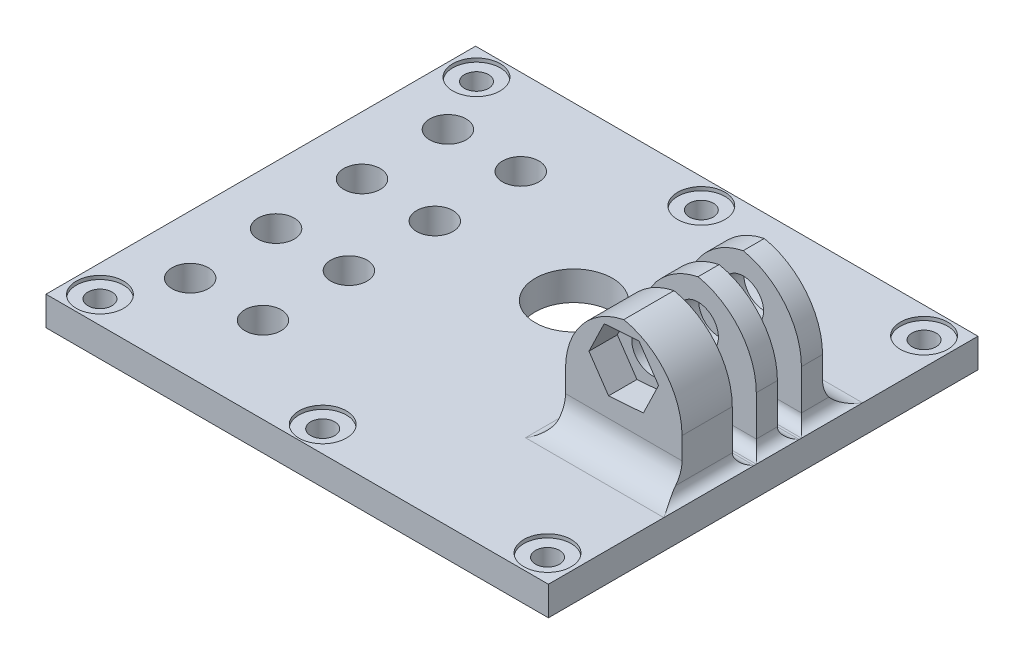
from build123d import *

# Parameters (mm, degrees)
SKETCH_1_W          = 69
SKETCH_1_H          = 59
EXTRUDE_1_DEPTH     = 4
SKETCH_2_R          = 1.65
CUT_EXTRUDE_1_DEPTH = 4
SKETCH_3_R          = 3.25
CUT_EXTRUDE_2_DEPTH = 0.5
SKETCH_4_W          = 16
SKETCH_4_H          = 2.9
SKETCH_4_H_2        = 6.9
EXTRUDE_2_DEPTH     = 17
SKETCH_5_R          = 2.8
CUT_EXTRUDE_3_DEPTH = 57.249199994
FILLET_1_R          = 10
FILLET_2_R          = 4
CUT_EXTRUDE_4_DEPTH = 3.9
FILLET_3_R          = 1.5
SKETCH_7_R          = 5.3
CUT_EXTRUDE_5_DEPTH = 4
SKETCH_8_R          = 2.5
CUT_EXTRUDE_6_DEPTH = 10


# Some blends are built 0.0001 mm under size
with BuildPart() as part:
    # Эскиз1 → Бобышка-Вытянуть1 (new body)
    with BuildSketch(Plane(origin=(0, 0, 0), x_dir=(1, 0, 0), z_dir=(0, 1, 0))):
        Rectangle(SKETCH_1_W, SKETCH_1_H)
    extrude(amount=EXTRUDE_1_DEPTH)

    # Эскиз2 → Вырез-Вытянуть1 (cut)
    with BuildSketch(Plane(origin=(0, 4, 0), x_dir=(1, 0, 0), z_dir=(0, 1, 0))):
        with Locations(Location((-30.734773913, -25.856238371, 0), (0, 0, 270))):
            Circle(SKETCH_2_R)
        with Locations(Location((-30.734773913, 25.856238371, 0), (0, 0, 270))):
            Circle(SKETCH_2_R)
        with Locations(Location((0, 26, 0), (0, 0, 270))):
            Circle(SKETCH_2_R)
        with Locations(Location((30.734773913, 25.856238371, 0), (0, 0, 270))):
            Circle(SKETCH_2_R)
        with Locations(Location((30.734773913, -25.856238371, 0), (0, 0, 270))):
            Circle(SKETCH_2_R)
        with Locations(Location((0, -26, 0), (0, 0, 270))):
            Circle(SKETCH_2_R)
    extrude(amount=-CUT_EXTRUDE_1_DEPTH, mode=Mode.SUBTRACT)

    # Эскиз3 → Вырез-Вытянуть2 (cut)
    with BuildSketch(Plane(origin=(0, 4, 0), x_dir=(1, 0, 0), z_dir=(0, 1, 0))):
        with Locations(Location((-30.734773913, 25.856238371, 0), (0, 0, 270))):
            Circle(SKETCH_3_R)
        with Locations(Location((0, 26, 0), (0, 0, 270))):
            Circle(SKETCH_3_R)
        with Locations(Location((30.734773913, 25.856238371, 0), (0, 0, 270))):
            Circle(SKETCH_3_R)
        with Locations(Location((30.734773913, -25.856238371, 0), (0, 0, 270))):
            Circle(SKETCH_3_R)
        with Locations(Location((0, -26, 0), (0, 0, 270))):
            Circle(SKETCH_3_R)
        with Locations(Location((-30.734773913, -25.856238371, 0), (0, 0, 270))):
            Circle(SKETCH_3_R)
    extrude(amount=-CUT_EXTRUDE_2_DEPTH, mode=Mode.SUBTRACT)

    # Эскиз4 → Бобышка-Вытянуть2 (add)
    with BuildSketch(Plane(origin=(0, 4, 0), x_dir=(1, 0, 0), z_dir=(0, 1, 0))):
        with Locations((25, 8.2)):
            Rectangle(SKETCH_4_W, SKETCH_4_H)
        with Locations((25, 2)):
            Rectangle(SKETCH_4_W, SKETCH_4_H)
        with Locations((25, -6.2)):
            Rectangle(SKETCH_4_W, SKETCH_4_H_2)
    extrude(amount=EXTRUDE_2_DEPTH)

    # Эскиз5 → Вырез-Вытянуть3 (cut, through all)
    with BuildSketch(Plane(origin=(0, 0, -9.65), x_dir=(-1, 0, 0), z_dir=(0, 0, -1))):
        with Locations((-25, 15)):
            Circle(SKETCH_5_R)
    extrude(amount=-CUT_EXTRUDE_3_DEPTH, mode=Mode.SUBTRACT)

    # Скругление1
    # the kernel refuses this fillet: 10 mm, written as the material it takes off along each edge
    with BuildSketch(Plane(origin=(33, 21, -34.65), x_dir=(0, -1, 0), z_dir=(0, 0, 1)), Plane(origin=(17, 21, 18.25), x_dir=(0, -1, 0), z_dir=(0, 0, -1)), Plane(origin=(17, 21, 24.45), x_dir=(0, -1, 0), z_dir=(0, 0, -1)), Plane(origin=(33, 21, -28.45), x_dir=(0, -1, 0), z_dir=(0, 0, 1))) as fillet_1_piece_1:
        with BuildLine():
            CenterArc((FILLET_1_R, -FILLET_1_R), FILLET_1_R, 90, 90)
            Line((0, -FILLET_1_R), (0, 0))
            Line((0, 0), (FILLET_1_R, 0))
        make_face()
    extrude(amount=52.9, mode=Mode.SUBTRACT)
    with BuildSketch(Plane(origin=(33, 21, -22.25), x_dir=(0, -1, 0), z_dir=(0, 0, 1)), Plane(origin=(17, 21, 34.65), x_dir=(0, -1, 0), z_dir=(0, 0, -1))) as fillet_1_piece_2:
        with BuildLine():
            CenterArc((FILLET_1_R, -FILLET_1_R), FILLET_1_R, 90, 90)
            Line((0, -FILLET_1_R), (0, 0))
            Line((0, 0), (FILLET_1_R, 0))
        make_face()
    extrude(amount=56.9, mode=Mode.SUBTRACT)

    # Скругление2
    fillet_2_edges = [part.edges().sort_by_distance(p)[0] for p in [
        (25, 4, 9.65),
        (25, 4, -9.65),
    ]]
    fillet(fillet_2_edges, radius=FILLET_2_R)

    # Эскиз6 → Вырез-Вытянуть4 (cut)
    with BuildSketch(Plane.XY.offset(9.65)):
        Polygon((20.220834242, 14.649417644), (22.914030347, 10.685829867), (27.693196105, 11.036412222), (29.779165758, 15.350582356), (27.085969653, 19.314170133), (22.306803895, 18.963587778), align=None)
    extrude(amount=-CUT_EXTRUDE_4_DEPTH, mode=Mode.SUBTRACT)

    # Скругление3
    fillet_3_edges = [part.edges().sort_by_distance(p)[0] for p in [
        (33, 4, 8.2),
        (25, 4, 2.75),
        (17, 4, 8.2),
        (33, 4, -10.2),
        (17, 4, -10.2),
        (25, 4, -6.75),
        (33, 4, -2),
        (25, 4, -3.45),
        (17, 4, -2),
        (25, 4, -0.55),
    ]]
    fillet(fillet_3_edges, radius=FILLET_3_R - 0.0001)  # a hair under: the kernel refuses the full size

    # Эскиз7 → Вырез-Вытянуть5 (cut)
    with BuildSketch(Plane(origin=(0, 4, 0), x_dir=(1, 0, 0), z_dir=(0, 1, 0))):
        with Locations(Location((2.5, 6, 0), (0, 0, 270))):
            Circle(SKETCH_7_R)
    extrude(amount=-CUT_EXTRUDE_5_DEPTH, mode=Mode.SUBTRACT)

    # Эскиз8 → Вырез-Вытянуть6 (cut)
    with BuildSketch(Plane(origin=(0, 4, 0), x_dir=(1, 0, 0), z_dir=(0, 1, 0))):
        with Locations(Location((-26.5, 17.7, 0), (0, 0, 270))):
            Circle(SKETCH_8_R)
        with Locations(Location((-26.5, 5.9, 0), (0, 0, 270))):
            Circle(SKETCH_8_R)
        with Locations(Location((-26.5, -5.9, 0), (0, 0, 270))):
            Circle(SKETCH_8_R)
        with Locations(Location((-26.5, -17.7, 0), (0, 0, 270))):
            Circle(SKETCH_8_R)
        with Locations(Location((-16.5, 17.7, 0), (0, 0, 270))):
            Circle(SKETCH_8_R)
        with Locations(Location((-16.5, 5.9, 0), (0, 0, 270))):
            Circle(SKETCH_8_R)
        with Locations(Location((-16.5, -5.9, 0), (0, 0, 270))):
            Circle(SKETCH_8_R)
        with Locations(Location((-16.5, -17.7, 0), (0, 0, 270))):
            Circle(SKETCH_8_R)
    extrude(amount=-CUT_EXTRUDE_6_DEPTH, mode=Mode.SUBTRACT)


solid = part.part
